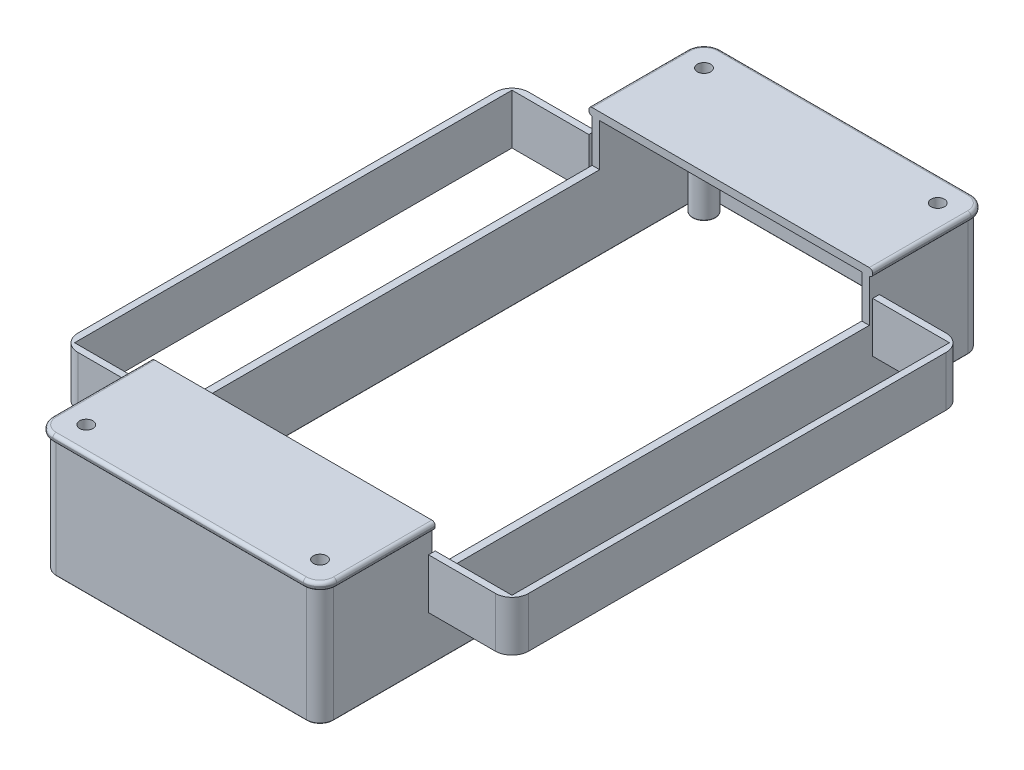
from build123d import *
from build123d.topology import SkipClean

# Parameters (mm, degrees)
SKETCH1_W             = 85
SKETCH1_H             = 200
BOSS_EXTRUDE1_DEPTH   = 2.25
SKETCH2_R             = 2
CUT_EXTRUDE1_DEPTH    = 2.25
FILLET1_R             = 5
FILLET2_R             = 1
BOSS_EXTRUDE2_DEPTH   = 35
SKETCH4_R             = 3.4
SKETCH4_R_2           = 2
BOSS_EXTRUDE3_DEPTH   = 35
FILLET3_R             = 0.2
SKETCH5_W             = 131
SKETCH5_H             = 131
CUT_EXTRUDE2_DEPTH    = 15
BOSS_EXTRUDE4_DEPTH   = 7.5
BOSS_EXTRUDE4_2_DEPTH = 7.5
FILLET4_R             = 5
FILLET5_R             = 5


with BuildPart() as part:
    # Sketch1 → Boss-Extrude1 (new body)
    with BuildSketch(Plane(origin=(0, 0, 0), x_dir=(1, 0, 0), z_dir=(0, 1, 0))):
        Rectangle(SKETCH1_W, SKETCH1_H)
    extrude(amount=BOSS_EXTRUDE1_DEPTH)

    # Sketch2 → Cut-Extrude1 (cut)
    with BuildSketch(Plane(origin=(0, 2.25, 0), x_dir=(1, 0, 0), z_dir=(0, 1, 0))):
        with Locations(Location((-35, 92.5, 0), (0, 0, 270))):
            Circle(SKETCH2_R)
        with Locations(Location((35, 92.5, 0), (0, 0, 270))):
            Circle(SKETCH2_R)
        with Locations(Location((35, -92.5, 0), (0, 0, 270))):
            Circle(SKETCH2_R)
        with Locations(Location((-35, -92.5, 0), (0, 0, 270))):
            Circle(SKETCH2_R)
    extrude(amount=-CUT_EXTRUDE1_DEPTH, mode=Mode.SUBTRACT)

    # Fillet1
    fillet1_edges = [part.edges().sort_by_distance(p)[0] for p in [
        (42.5, 1.125, 100),
        (-42.5, 1.125, 100),
        (-42.5, 1.125, -100),
        (42.5, 1.125, -100),
    ]]
    fillet(fillet1_edges, radius=FILLET1_R)

    # Fillet2
    fillet2_edges = [part.edges().sort_by_distance(p)[0] for p in [
        (-42.5, 0, 0),
        (-42.5, 2.25, 0),
        (42.5, 0, 0),
        (0, 0, 100),
        (0, 0, -100),
        (-41.035533906, 0, 98.535533906),
        (41.035533906, 0, 98.535533906),
        (41.035533906, 0, -98.535533906),
        (-41.035533906, 0, -98.535533906),
        (0, 2.25, -100),
        (42.5, 2.25, 0),
        (0, 2.25, 100),
        (-41.035533906, 2.25, 98.535533906),
        (41.035533906, 2.25, 98.535533906),
        (41.035533906, 2.25, -98.535533906),
        (-41.035533906, 2.25, -98.535533906),
    ]]
    fillet(fillet2_edges, radius=FILLET2_R)

    # Sketch3 → Boss-Extrude2 (add)
    with BuildSketch(Plane.XZ):
        with BuildLine():
            Line((-37.5, -99), (37.5, -99))
            ThreePointArc((37.5, -99), (40.328427125, -97.828427125), (41.5, -95))
            Line((41.5, -95), (41.5, 95))
            ThreePointArc((41.5, 95), (40.328427125, 97.828427125), (37.5, 99))
            Line((37.5, 99), (-37.5, 99))
            ThreePointArc((-37.5, 99), (-40.328427125, 97.828427125), (-41.5, 95))
            Line((-41.5, 95), (-41.5, -95))
            ThreePointArc((-41.5, -95), (-40.328427125, -97.828427125), (-37.5, -99))
        make_face()
        with BuildLine():
            Line((37.5, 96.75), (-37.5, 96.75))
            ThreePointArc((-37.5, 96.75), (-38.737436867, 96.237436867), (-39.25, 95))
            Line((-39.25, 95), (-39.25, -95))
            ThreePointArc((-39.25, -95), (-38.737436867, -96.237436867), (-37.5, -96.75))
            Line((-37.5, -96.75), (37.5, -96.75))
            ThreePointArc((37.5, -96.75), (38.737436867, -96.237436867), (39.25, -95))
            Line((39.25, -95), (39.25, 95))
            ThreePointArc((39.25, 95), (38.737436867, 96.237436867), (37.5, 96.75))
        make_face(mode=Mode.SUBTRACT)
    extrude(amount=BOSS_EXTRUDE2_DEPTH)

    # Sketch4 → Boss-Extrude3 (add)
    # profile 1 of 4: a face of its own
    with SkipClean():  # the faces are left unmerged after this step: merging them gives an invalid solid
        with BuildSketch(Plane.XZ):
            with Locations(Location((-35, 92.5, 0), (0, 0, 90))):
                Circle(SKETCH4_R)
            with Locations(Location((-35, 92.5, 0), (0, 0, 270))):
                Circle(SKETCH4_R_2, mode=Mode.SUBTRACT)
        # profile 2 of 4: a face of its own
        with BuildSketch(Plane.XZ):
            with Locations(Location((35, 92.5, 0), (0, 0, 90))):
                Circle(SKETCH4_R)
            with Locations(Location((35, 92.5, 0), (0, 0, 270))):
                Circle(SKETCH4_R_2, mode=Mode.SUBTRACT)
        # profile 3 of 4: a face of its own
        with BuildSketch(Plane.XZ):
            with Locations(Location((-35, -92.5, 0), (0, 0, 90))):
                Circle(SKETCH4_R)
            with Locations(Location((-35, -92.5, 0), (0, 0, 90))):
                Circle(SKETCH4_R_2, mode=Mode.SUBTRACT)
        # profile 4 of 4: a face of its own
        with BuildSketch(Plane.XZ):
            with Locations(Location((35, -92.5, 0), (0, 0, 90))):
                Circle(SKETCH4_R)
            with Locations(Location((35, -92.5, 0), (0, 0, 90))):
                Circle(SKETCH4_R_2, mode=Mode.SUBTRACT)
        extrude(amount=BOSS_EXTRUDE3_DEPTH)
    add(part.part.scale(1), mode=Mode.REPLACE)  # the faces are merged on a copy

    # Fillet3
    fillet3_edges = [part.edges().sort_by_distance(p)[0] for p in [
        (-40.328427125, -35, -97.828427125),
        (0, -35, -99),
        (40.328427125, -35, -97.828427125),
        (41.5, -35, 0),
        (40.328427125, -35, 97.828427125),
        (0, -35, 99),
        (-40.328427125, -35, 97.828427125),
        (-41.5, -35, 0),
        (38.737436867, -35, 96.237436867),
        (0, -35, 96.75),
        (-38.737436867, -35, 96.237436867),
        (-39.25, -35, 0),
        (-38.737436867, -35, -96.237436867),
        (0, -35, -96.75),
        (38.737436867, -35, -96.237436867),
        (39.25, -35, 0),
        (-35, -35, 94.5),
        (-35, -35, 89.1),
        (35, -35, 94.5),
        (-35, -35, -94.5),
        (-35, -35, -95.9),
        (35, -35, -94.5),
        (35, -35, -95.9),
    ]]
    fillet(fillet3_edges, radius=FILLET3_R)

    # Sketch5 → Cut-Extrude2 (cut)
    with BuildSketch(Plane(origin=(0, 2.25, 0), x_dir=(1, 0, 0), z_dir=(0, 1, 0))):
        Rectangle(SKETCH5_W, SKETCH5_H)
    extrude(amount=-CUT_EXTRUDE2_DEPTH, mode=Mode.SUBTRACT)


with BuildPart() as body_2:
    # Sketch6 → Boss-Extrude4 (new, symmetric)
    with BuildSketch(Plane(origin=(0, -12.75, 0), x_dir=(1, 0, 0), z_dir=(0, 1, 0))):
        Polygon((-65.5, -65.5), (-42.5, -65.5), (-42.5, -67.5), (-67.5, -67.5), (-67.5, 67.5), (-42.5, 67.5), (-42.5, 65.5), (-65.5, 65.5), align=None)
    extrude(amount=BOSS_EXTRUDE4_DEPTH, both=True)

    # Fillet4
    fillet4_edges = [body_2.edges().sort_by_distance(p)[0] for p in [
        (-67.5, -12.75, 67.5),
        (-67.5, -12.75, -67.5),
    ]]
    fillet(fillet4_edges, radius=FILLET4_R)


with BuildPart() as body_3:
    # Sketch6 → Boss-Extrude4 2 (new, symmetric)
    with BuildSketch(Plane(origin=(0, -12.75, 0), x_dir=(1, 0, 0), z_dir=(0, 1, 0))):
        Polygon((65.5, 65.5), (65.5, -65.5), (42.5, -65.5), (42.5, -67.5), (67.5, -67.5), (67.5, 67.5), (42.5, 67.5), (42.5, 65.5), align=None)
    extrude(amount=BOSS_EXTRUDE4_2_DEPTH, both=True)

    # Fillet5
    fillet5_edges = [body_3.edges().sort_by_distance(p)[0] for p in [
        (67.5, -12.75, -67.5),
        (67.5, -12.75, 67.5),
    ]]
    fillet(fillet5_edges, radius=FILLET5_R)


solid = Compound([part.part, body_2.part, body_3.part])
